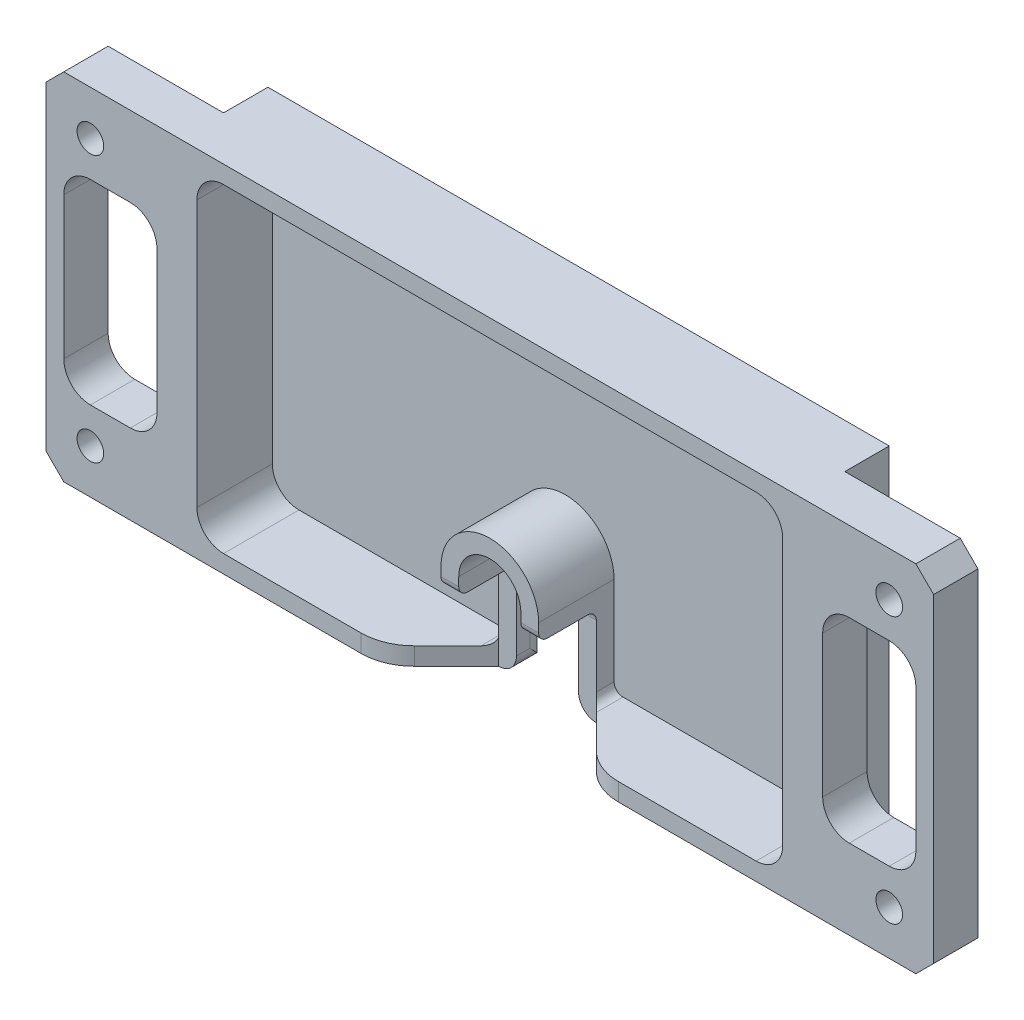
from build123d import *

# Parameters (mm, degrees)
AUFSATZ_LINEAR_AUSTRAGEN1_DEPTH      = 2.5
AUFSATZ_LINEAR_AUSTRAGEN1_DEPTH_BACK = 2.5
SKIZZE1_W                            = 100
SKIZZE1_H                            = 40
SCHNITT_LINEAR_AUSTRAGEN1_DEPTH      = 54.909646632
SCHNITT_LINEAR_AUSTRAGEN1_DEPTH_BACK = 54.909646632
SKIZZE2_R                            = 1.5
SCHNITT_LINEAR_AUSTRAGEN2_DEPTH      = 54.909646632
SCHNITT_LINEAR_AUSTRAGEN2_DEPTH_BACK = 54.909646632
SKIZZE7_W                            = 70
SKIZZE7_H                            = 40
AUFSATZ_LINEAR_AUSTRAGEN3_DEPTH      = 5
FASE1_SIZE                           = 2
SCHNITT_LINEAR_AUSTRAGEN7_DEPTH      = 55.371407927
SCHNITT_LINEAR_AUSTRAGEN7_DEPTH_BACK = 55.371407927
VERRUNDUNG1_R                        = 2
SCHNITT_LINEAR_AUSTRAGEN6_DEPTH      = 8.5
VERRUNDUNG2_R                        = 2
SCHNITT_LINEAR_AUSTRAGEN8_DEPTH      = 59.285933123
VERRUNDUNG3_R                        = 1
VERRUNDUNG4_R                        = 6


with BuildPart() as part:
    # Skizze1 → Aufsatz-Linear austragen1 (new, two sides: drawn at the far end of the back side and taken through both)
    with BuildSketch(Plane.XY.offset(-AUFSATZ_LINEAR_AUSTRAGEN1_DEPTH_BACK)):
        Rectangle(SKIZZE1_W, SKIZZE1_H)
    extrude(amount=AUFSATZ_LINEAR_AUSTRAGEN1_DEPTH + AUFSATZ_LINEAR_AUSTRAGEN1_DEPTH_BACK)

    # Skizze2 → Schnitt-Linear austragen1 (cut, two sides: drawn at the far end of the back side and taken through both)
    with BuildSketch(Plane.XY.offset(-SCHNITT_LINEAR_AUSTRAGEN1_DEPTH_BACK)):
        with Locations((-45, 15)):
            Circle(SKIZZE2_R)
        with Locations(Location((-45, -15, 0), (0, 0, 180))):
            Circle(SKIZZE2_R)
        with Locations((45, -15)):
            Circle(SKIZZE2_R)
        with Locations(Location((45, 15, 0), (0, 0, 180))):
            Circle(SKIZZE2_R)
    extrude(amount=SCHNITT_LINEAR_AUSTRAGEN1_DEPTH + SCHNITT_LINEAR_AUSTRAGEN1_DEPTH_BACK, mode=Mode.SUBTRACT)

    # Skizze4 → Schnitt-Linear austragen2 (cut, two sides: drawn at the far end of the back side and taken through both)
    with BuildSketch(Plane.XY.offset(-SCHNITT_LINEAR_AUSTRAGEN2_DEPTH_BACK)):
        with BuildLine():
            Line((-48, -8), (-48, 8))
            ThreePointArc((-48, 8), (-47.121320344, 10.121320344), (-45, 11))
            Line((-45, 11), (-40.5, 11))
            ThreePointArc((-40.5, 11), (-38.378679656, 10.121320344), (-37.5, 8))
            Line((-37.5, 8), (-37.5, -8))
            ThreePointArc((-37.5, -8), (-38.378679656, -10.121320344), (-40.5, -11))
            Line((-40.5, -11), (-45, -11))
            ThreePointArc((-45, -11), (-47.121320344, -10.121320344), (-48, -8))
        make_face()
        with BuildLine():
            Line((45, -11), (40.5, -11))
            ThreePointArc((40.5, -11), (38.378679656, -10.121320344), (37.5, -8))
            Line((37.5, -8), (37.5, 8))
            ThreePointArc((37.5, 8), (38.378679656, 10.121320344), (40.5, 11))
            Line((40.5, 11), (45, 11))
            ThreePointArc((45, 11), (47.121320344, 10.121320344), (48, 8))
            Line((48, 8), (48, -8))
            ThreePointArc((48, -8), (47.121320344, -10.121320344), (45, -11))
        make_face()
    extrude(amount=SCHNITT_LINEAR_AUSTRAGEN2_DEPTH + SCHNITT_LINEAR_AUSTRAGEN2_DEPTH_BACK, mode=Mode.SUBTRACT)

    # Skizze7 → Aufsatz-Linear austragen3 (add)
    with BuildSketch(Plane(origin=(0, 0, -2.5), x_dir=(-1, 0, 0), z_dir=(0, 0, -1))):
        Rectangle(SKIZZE7_W, SKIZZE7_H)
    extrude(amount=AUFSATZ_LINEAR_AUSTRAGEN3_DEPTH)

    # Fase1
    fase1_edges = [part.edges().sort_by_distance(p)[0] for p in [
        (50, 20, 0),
        (50, -20, 0),
        (-50, -20, 0),
        (-50, 20, 0),
    ]]
    chamfer(fase1_edges, length=FASE1_SIZE)

    # Skizze9 → Schnitt-Linear austragen7 (cut, two sides: drawn at the far end of the back side and taken through both)
    with BuildSketch(Plane.XY.offset(-SCHNITT_LINEAR_AUSTRAGEN7_DEPTH_BACK)):
        with BuildLine():
            Line((-3.5, -20), (3.5, -20))
            Line((3.5, -20), (3.5, -7))
            ThreePointArc((3.5, -7), (0, -3.5), (-3.5, -7))
            Line((-3.5, -7), (-3.5, -20))
        make_face()
    extrude(amount=SCHNITT_LINEAR_AUSTRAGEN7_DEPTH + SCHNITT_LINEAR_AUSTRAGEN7_DEPTH_BACK, mode=Mode.SUBTRACT)

    # Verrundung1
    verrundung1_edges = [part.edges().sort_by_distance(p)[0] for p in [
        (3.5, -20, -2.5),
        (-3.5, -20, -2.5),
    ]]
    fillet(verrundung1_edges, radius=VERRUNDUNG1_R)

    # Skizze8 → Schnitt-Linear austragen6 (cut)
    with BuildSketch(Plane.XY.offset(2.5)):
        with BuildLine():
            Line((6.5, -18), (30, -18))
            ThreePointArc((30, -18), (32.121320344, -17.121320344), (33, -15))
            Line((33, -15), (33, 15))
            ThreePointArc((33, 15), (32.121320344, 17.121320344), (30, 18))
            Line((30, 18), (-30, 18))
            ThreePointArc((-30, 18), (-32.121320344, 17.121320344), (-33, 15))
            Line((-33, 15), (-33, -15))
            ThreePointArc((-33, -15), (-32.121320344, -17.121320344), (-30, -18))
            Line((-30, -18), (-6.5, -18))
            ThreePointArc((-6.5, -18), (-5.792893219, -17.707106781), (-5.5, -17))
            Line((-5.5, -17), (-5.5, -7))
            ThreePointArc((-5.5, -7), (0, -1.5), (5.5, -7))
            Line((5.5, -7), (5.5, -17))
            ThreePointArc((5.5, -17), (5.792893219, -17.707106781), (6.5, -18))
        make_face()
    extrude(amount=-SCHNITT_LINEAR_AUSTRAGEN6_DEPTH, mode=Mode.SUBTRACT)

    # Verrundung2
    # the kernel refuses this fillet: 2 mm, written as the material it takes off along each edge
    with BuildSketch(Plane(origin=(-3.5, -7, -7.5), x_dir=(0, 0, 1), z_dir=(0, -1, 0)), Plane(origin=(3.5, -23, -7.5), x_dir=(0, 0, 1), z_dir=(0, 1, 0))) as verrundung2_piece_1:
        with BuildLine():
            CenterArc((VERRUNDUNG2_R, VERRUNDUNG2_R), VERRUNDUNG2_R, 180, 90)
            Line((0, VERRUNDUNG2_R), (0, 0))
            Line((0, 0), (VERRUNDUNG2_R, 0))
        make_face()
    extrude(amount=16, mode=Mode.SUBTRACT)
    with BuildSketch(Plane(origin=(0, -7, -7.5), x_dir=(-1, 0, 0), z_dir=(0, -1, 0))) as verrundung2_piece_2:
        with BuildLine():
            CenterArc((3.5 + VERRUNDUNG2_R, -VERRUNDUNG2_R), VERRUNDUNG2_R, 90, 90)
            Line((3.5 + VERRUNDUNG2_R, 0), (3.5, 0))
            Line((3.5, 0), (3.5, -VERRUNDUNG2_R))
        make_face()
    revolve(axis=Axis((0, -7, -7.5), (0, 0, -1)), revolution_arc=180, mode=Mode.SUBTRACT)

    # Skizze10 → Schnitt-Linear austragen8 (cut, through all)
    with BuildSketch(Plane(origin=(0, -9, 0), x_dir=(1, 0, 0), z_dir=(0, 1, 0))):
        Polygon((12, -2.5), (5.5, 4), (-5.5, 4), (-12, -2.5), align=None)
    extrude(amount=-SCHNITT_LINEAR_AUSTRAGEN8_DEPTH, mode=Mode.SUBTRACT)

    # Verrundung3
    verrundung3_edges = [part.edges().sort_by_distance(p)[0] for p in [
        (4.5, -9, 2.5),
        (4.5, -9, -4),
        (-4.5, -9, -4),
        (-4.5, -9, 2.5),
    ]]
    fillet(verrundung3_edges, radius=VERRUNDUNG3_R)

    # Verrundung4
    verrundung4_edges = [part.edges().sort_by_distance(p)[0] for p in [
        (12, -19, 2.5),
        (-12, -19, 2.5),
    ]]
    fillet(verrundung4_edges, radius=VERRUNDUNG4_R)


solid = part.part
